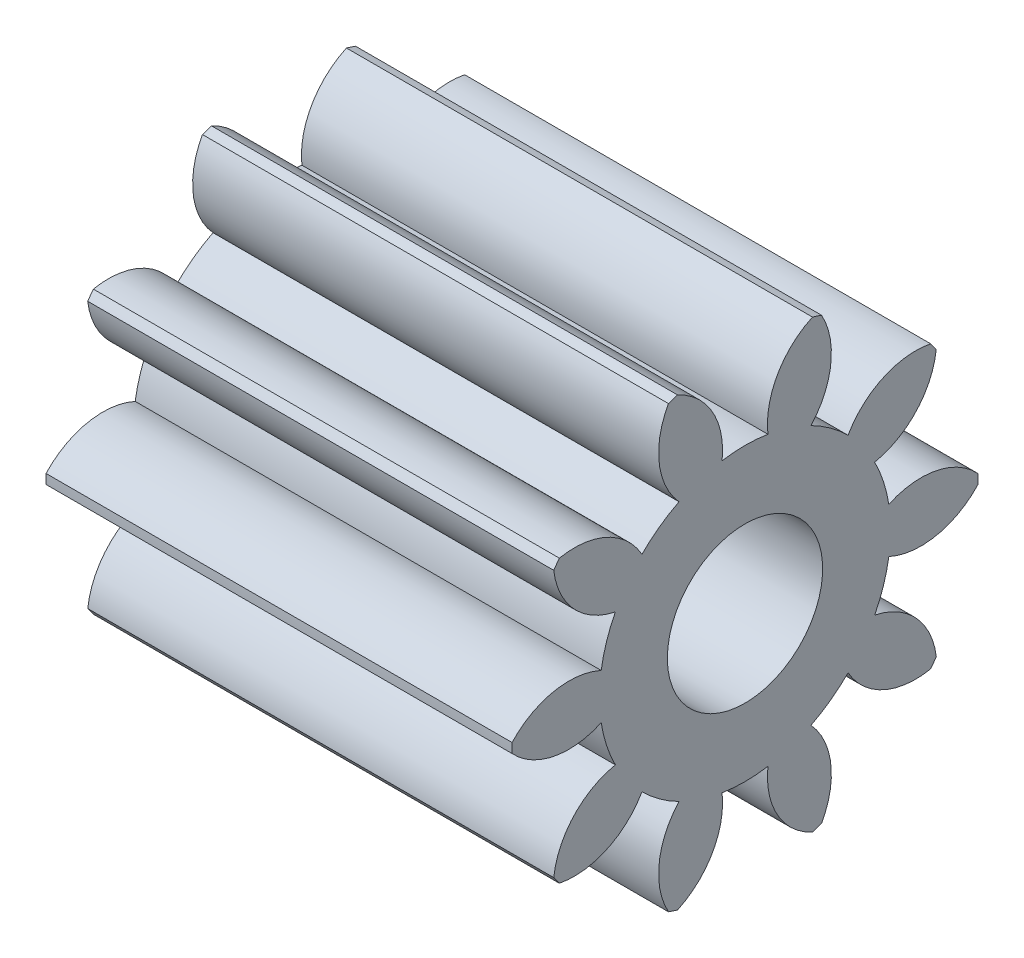
from build123d import *

# Parameters (mm, degrees)
BASPROSKE_W     = 15
BASPROSKE_H     = 7.5
TOOTHCUT_DEPTH  = 19.371173071
TEETHCUTS_COUNT = 10
TEETHCUTS_ANGLE = 324
BORSKE_R        = 2.5
BORE_DEPTH      = 50.0000508


with BuildPart() as part:
    # BasProSke → Base-Revolve (revolve)
    with BuildSketch(Plane(origin=(0, 0, 0), x_dir=(1, 0, 0), z_dir=(0, 1, 0))):
        with Locations((7.5, 3.75)):
            Rectangle(BASPROSKE_W, BASPROSKE_H)
    revolve(axis=Axis((-10, 0, 0), (1, 0, 0)))

    # TooCutSke → ToothCut (cut, through all)
    with BuildSketch(Plane(origin=(0, 0, 0), x_dir=(0, 0, -1), z_dir=(1, 0, 0))):
        with BuildLine():
            ThreePointArc((0.737676151, 4.628079099), (0, 4.6865), (-0.737676151, 4.628079099))
            ThreePointArc((-0.737676151, 4.628079099), (-1.051542781, 6.151798382), (-2.205760267, 7.194877817))
            ThreePointArc((-2.205760267, 7.194877817), (0, 7.5254), (2.205760267, 7.194877817))
            ThreePointArc((2.205760267, 7.194877817), (1.051542781, 6.151798382), (0.737676151, 4.628079099))
        make_face()
    toothcut = extrude(amount=TOOTHCUT_DEPTH, mode=Mode.SUBTRACT)

    # TeethCuts: ToothCut ×10 about axis
    teethcuts_axis = Axis((-10, 0, 0), (1, 0, 0))
    for i in range(1, TEETHCUTS_COUNT):
        add(toothcut.rotate(teethcuts_axis, i * TEETHCUTS_ANGLE / (TEETHCUTS_COUNT - 1)), mode=Mode.SUBTRACT)

    # BorSke → Bore (cut, symmetric)
    with BuildSketch(Plane(origin=(0, 0, 0), x_dir=(0, 0, -1), z_dir=(1, 0, 0))):
        Circle(BORSKE_R)
    extrude(amount=BORE_DEPTH, both=True, mode=Mode.SUBTRACT)


solid = part.part
